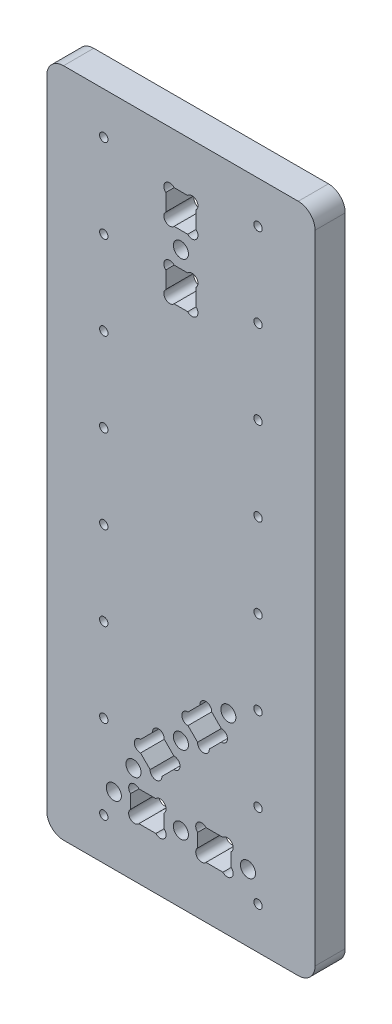
from build123d import *

# Parameters (mm, degrees)
ESQUISSE1_W                  = 80
ESQUISSE1_H                  = 200
BOSS_EXTRU_1_DEPTH           = 9
ENL_V_MAT_EXTRU_1_DEPTH      = 216.594526832
ENL_V_MAT_EXTRU_1_DEPTH_BACK = 216.594526832
ESQUISSE2_R                  = 1.25
ENL_V_MAT_EXTRU_2_DEPTH      = 216.594526832
ENL_V_MAT_EXTRU_2_DEPTH_BACK = 216.594526832
CONG_1_R                     = 5
ENL_V_MAT_EXTRU_3_DEPTH      = 216.594526832
ENL_V_MAT_EXTRU_3_DEPTH_BACK = 216.594526832
ESQUISSE4_R                  = 2.25
ENL_V_MAT_EXTRU_4_DEPTH      = 216.594526832
ENL_V_MAT_EXTRU_4_DEPTH_BACK = 216.594526832
ESQUISSE5_R                  = 2.25


with BuildPart() as part:
    # Esquisse1 → Boss.-Extru.1 (new body)
    with BuildSketch(Plane.XY):
        with Locations((40, 100)):
            Rectangle(ESQUISSE1_W, ESQUISSE1_H)
    extrude(amount=BOSS_EXTRU_1_DEPTH)

    # Esquisse2 → Enlèv. mat.-Extru.1 (cut, two sides: drawn at the far end of the back side and taken through both)
    with BuildSketch(Plane.XY.offset(9).offset(-ENL_V_MAT_EXTRU_1_DEPTH_BACK)):
        with Locations((17, 187.5)):
            Circle(ESQUISSE2_R)
        with Locations((17, 87.5)):
            Circle(ESQUISSE2_R)
        with Locations((17, 62.5)):
            Circle(ESQUISSE2_R)
        with Locations((17, 37.5)):
            Circle(ESQUISSE2_R)
        with Locations((17, 12.5)):
            Circle(ESQUISSE2_R)
        with Locations((17, 162.5)):
            Circle(ESQUISSE2_R)
        with Locations((17, 137.5)):
            Circle(ESQUISSE2_R)
        with Locations((17, 112.5)):
            Circle(ESQUISSE2_R)
        with Locations((63, 112.5)):
            Circle(ESQUISSE2_R)
        with Locations((63, 137.5)):
            Circle(ESQUISSE2_R)
        with Locations((63, 162.5)):
            Circle(ESQUISSE2_R)
        with Locations((63, 12.5)):
            Circle(ESQUISSE2_R)
        with Locations((63, 37.5)):
            Circle(ESQUISSE2_R)
        with Locations((63, 62.5)):
            Circle(ESQUISSE2_R)
        with Locations((63, 87.5)):
            Circle(ESQUISSE2_R)
        with Locations((63, 187.5)):
            Circle(ESQUISSE2_R)
    extrude(amount=ENL_V_MAT_EXTRU_1_DEPTH + ENL_V_MAT_EXTRU_1_DEPTH_BACK, mode=Mode.SUBTRACT)

    # Esquisse3 → Enlèv. mat.-Extru.2 (cut, two sides: drawn at the far end of the back side and taken through both)
    with BuildSketch(Plane.XY.offset(9).offset(-ENL_V_MAT_EXTRU_2_DEPTH_BACK)):
        Polygon((46.717514421, 43.535533906), (53.788582233, 50.606601718), (47.424621202, 56.970562748), (40.353553391, 49.899494937), align=None)
        Polygon((33.282485579, 42.828427125), (39.646446609, 36.464466094), (32.575378798, 29.393398282), (26.211417767, 35.757359313), align=None)
    extrude(amount=ENL_V_MAT_EXTRU_2_DEPTH + ENL_V_MAT_EXTRU_2_DEPTH_BACK, mode=Mode.SUBTRACT)

    # Congé1
    cong_1_edges = [part.edges().sort_by_distance(p)[0] for p in [
        (0, 200, 4.5),
        (80, 200, 4.5),
        (80, 0, 4.5),
        (0, 0, 4.5),
    ]]
    fillet(cong_1_edges, radius=CONG_1_R)

    # Esquisse4 → Enlèv. mat.-Extru.3 (cut, two sides: drawn at the far end of the back side and taken through both)
    with BuildSketch(Plane.XY.offset(9).offset(-ENL_V_MAT_EXTRU_3_DEPTH_BACK)):
        with Locations((40, 43.181980515)):
            Circle(ESQUISSE4_R)
        with Locations((25.857864376, 29.039844892)):
            Circle(ESQUISSE4_R)
        with Locations((54.142135624, 57.324116139)):
            Circle(ESQUISSE4_R)
        with BuildLine():
            Line((27.961417767, 37.507359313), (27.961417767, 34.007359313))
            ThreePointArc((27.961417767, 34.007359313), (26.111417767, 35.757359313), (27.961417767, 37.507359313))
        make_face()
        with BuildLine():
            Line((31.532485579, 41.078427125), (35.032485579, 41.078427125))
            ThreePointArc((35.032485579, 41.078427125), (33.282485579, 42.928427125), (31.532485579, 41.078427125))
        make_face()
        with BuildLine():
            Line((37.896446609, 34.714466094), (37.896446609, 38.214466094))
            ThreePointArc((37.896446609, 38.214466094), (39.746446609, 36.464466094), (37.896446609, 34.714466094))
        make_face()
        with BuildLine():
            Line((34.325378798, 31.143398282), (30.825378798, 31.143398282))
            ThreePointArc((30.825378798, 31.143398282), (32.575378798, 29.293398282), (34.325378798, 31.143398282))
        make_face()
        with BuildLine():
            Line((52.038582233, 48.856601718), (52.038582233, 52.356601718))
            ThreePointArc((52.038582233, 52.356601718), (53.888582233, 50.606601718), (52.038582233, 48.856601718))
        make_face()
        with BuildLine():
            Line((48.467514421, 45.285533906), (44.967514421, 45.285533906))
            ThreePointArc((44.967514421, 45.285533906), (46.717514421, 43.435533906), (48.467514421, 45.285533906))
        make_face()
        with BuildLine():
            Line((42.103553391, 51.649494937), (42.103553391, 48.149494937))
            ThreePointArc((42.103553391, 48.149494937), (40.253553391, 49.899494937), (42.103553391, 51.649494937))
        make_face()
        with BuildLine():
            Line((45.674621202, 55.220562748), (49.174621202, 55.220562748))
            ThreePointArc((49.174621202, 55.220562748), (47.424621202, 57.070562748), (45.674621202, 55.220562748))
        make_face()
    extrude(amount=ENL_V_MAT_EXTRU_3_DEPTH + ENL_V_MAT_EXTRU_3_DEPTH_BACK, mode=Mode.SUBTRACT)

    # Esquisse5 → Enlèv. mat.-Extru.4 (cut, two sides: drawn at the far end of the back side and taken through both)
    with BuildSketch(Plane.XY.offset(9).offset(-ENL_V_MAT_EXTRU_4_DEPTH_BACK)):
        with Locations((60, 20)):
            Circle(ESQUISSE5_R)
        with Locations((40, 20)):
            Circle(ESQUISSE5_R)
        with Locations((20, 20)):
            Circle(ESQUISSE5_R)
        with Locations((40, 170)):
            Circle(ESQUISSE5_R)
        with BuildLine():
            Line((52.525126266, 15.5), (47.474873734, 15.5))
            ThreePointArc((47.474873734, 15.5), (44.929289322, 15.429289322), (45, 17.974873734))
            Line((45, 17.974873734), (45, 22.025126266))
            ThreePointArc((45, 22.025126266), (44.929289322, 24.570710678), (47.474873734, 24.5))
            Line((47.474873734, 24.5), (52.525126266, 24.5))
            ThreePointArc((52.525126266, 24.5), (55.070710678, 24.570710678), (55, 22.025126266))
            Line((55, 22.025126266), (55, 17.974873734))
            ThreePointArc((55, 17.974873734), (55.070710678, 15.429289322), (52.525126266, 15.5))
        make_face()
        with BuildLine():
            Line((32.525126266, 15.5), (27.474873734, 15.5))
            ThreePointArc((27.474873734, 15.5), (24.929289322, 15.429289322), (25, 17.974873734))
            Line((25, 17.974873734), (25, 22.025126266))
            ThreePointArc((25, 22.025126266), (24.929289322, 24.570710678), (27.474873734, 24.5))
            Line((27.474873734, 24.5), (32.525126266, 24.5))
            ThreePointArc((32.525126266, 24.5), (35.070710678, 24.570710678), (35, 22.025126266))
            Line((35, 22.025126266), (35, 17.974873734))
            ThreePointArc((35, 17.974873734), (35.070710678, 15.429289322), (32.525126266, 15.5))
        make_face()
        with BuildLine():
            Line((44.5, 182.525126266), (44.5, 177.474873734))
            ThreePointArc((44.5, 177.474873734), (44.570710678, 174.929289322), (42.025126266, 175))
            Line((42.025126266, 175), (37.974873734, 175))
            ThreePointArc((37.974873734, 175), (35.429289322, 174.929289322), (35.5, 177.474873734))
            Line((35.5, 177.474873734), (35.5, 182.525126266))
            ThreePointArc((35.5, 182.525126266), (35.429289322, 185.070710678), (37.974873734, 185))
            Line((37.974873734, 185), (42.025126266, 185))
            ThreePointArc((42.025126266, 185), (44.570710678, 185.070710678), (44.5, 182.525126266))
        make_face()
        with BuildLine():
            Line((44.5, 162.525126266), (44.5, 157.474873734))
            ThreePointArc((44.5, 157.474873734), (44.570710678, 154.929289322), (42.025126266, 155))
            Line((42.025126266, 155), (37.974873734, 155))
            ThreePointArc((37.974873734, 155), (35.429289322, 154.929289322), (35.5, 157.474873734))
            Line((35.5, 157.474873734), (35.5, 162.525126266))
            ThreePointArc((35.5, 162.525126266), (35.429289322, 165.070710678), (37.974873734, 165))
            Line((37.974873734, 165), (42.025126266, 165))
            ThreePointArc((42.025126266, 165), (44.570710678, 165.070710678), (44.5, 162.525126266))
        make_face()
    extrude(amount=ENL_V_MAT_EXTRU_4_DEPTH + ENL_V_MAT_EXTRU_4_DEPTH_BACK, mode=Mode.SUBTRACT)


solid = part.part
